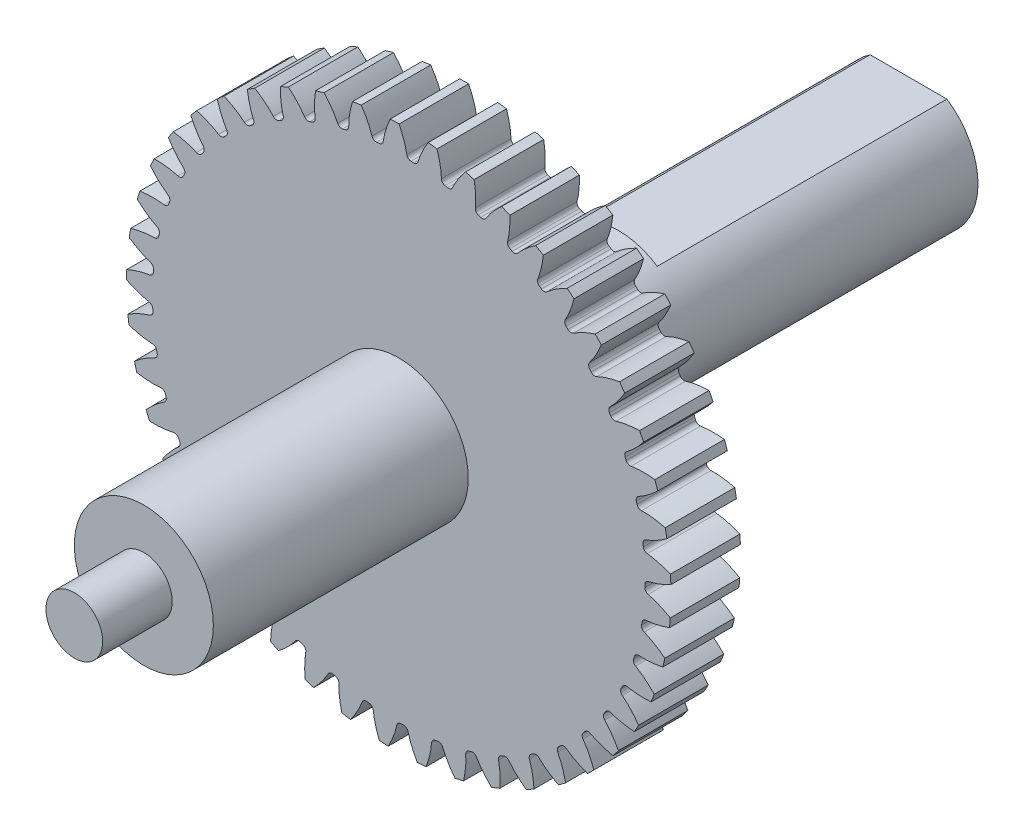
from build123d import *

# Parameters (mm, degrees)
SKETCH1_R           = 3
BOSS_EXTRUDE1_DEPTH = 33
SKETCH1_3_R         = 1.225
BOSS_EXTRUDE2_DEPTH = 36
CUT_EXTRUDE1_DEPTH  = 12.5
SKETCH5_R           = 10.625
BOSS_EXTRUDE3_DEPTH = 3
BOSS_EXTRUDE5_DEPTH = 3
CIRPATTERN1_COUNT   = 45


with BuildPart() as part:
    # Sketch1 → Boss-Extrude1 (new body)
    with BuildSketch(Plane.XY):
        Circle(SKETCH1_R)
    extrude(amount=BOSS_EXTRUDE1_DEPTH)

    # Sketch1<3> → Boss-Extrude2 (add)
    with BuildSketch(Plane.XY):
        Circle(SKETCH1_3_R)
    extrude(amount=BOSS_EXTRUDE2_DEPTH)

    # Sketch3 → Cut-Extrude1 (cut)
    with BuildSketch(Plane(origin=(0, 0, 0), x_dir=(-1, 0, 0), z_dir=(0, 0, -1))):
        with BuildLine():
            Line((-1.658312395, 2.5), (1.658312395, 2.5))
            ThreePointArc((1.658312395, 2.5), (0, 3), (-1.658312395, 2.5))
        make_face()
    extrude(amount=-CUT_EXTRUDE1_DEPTH, mode=Mode.SUBTRACT)

    # Sketch5 → Boss-Extrude3 (add)
    with BuildSketch(Plane.XY.offset(19)):
        Circle(SKETCH5_R)
    extrude(amount=BOSS_EXTRUDE3_DEPTH)

    # Sketch5<3> → Boss-Extrude5 (add)
    with BuildSketch(Plane.XY.offset(19)):
        with BuildLine():
            add(Edge.make_bspline(
                [(10.776484352, 0.02719463), (10.806732004, 0.033258222), (10.86082589, 0.045217944), (10.938321541, 0.06482523), (11.038588861, 0.094249349), (11.131873873, 0.124747653), (11.224305748, 0.157895215), (11.315781025, 0.193362424), (11.425813466, 0.239194384), (11.544483316, 0.292654479), (11.639659509, 0.339180983), (11.711835129, 0.376368108), (11.743425413, 0.393013451)],
                knots=[0.05770511, 0.05770511, 0.05770511, 0.05770511, 0.05770511, 0.092110525, 0.119476176, 0.146842496, 0.174208854, 0.201574956, 0.228941013, 0.256307345, 0.307035032, 0.346884984, 0.346884984, 0.346884984, 0.346884984, 0.346884984], degree=4))
            ThreePointArc((11.743425413, 0.393013451), (11.735426348, 0.585037119), (11.724287601, 0.776904266))
            add(Edge.make_bspline(
                [(10.725757452, 1.044739973), (10.7564582, 1.041714795), (10.81147336, 1.035194402), (10.890534862, 1.023391838), (10.993231483, 1.004085923), (11.089087251, 0.983016708), (11.1843576, 0.95922652), (11.278906799, 0.933033045), (11.392952003, 0.898371854), (11.516350463, 0.856979402), (11.615682156, 0.82014955), (11.691198447, 0.790325195), (11.724287601, 0.776904266)],
                knots=[0.05770511, 0.05770511, 0.05770511, 0.05770511, 0.05770511, 0.092110525, 0.119476176, 0.146842496, 0.174208854, 0.201574956, 0.228941013, 0.256307345, 0.307035032, 0.346884984, 0.346884984, 0.346884984, 0.346884984, 0.346884984], degree=4))
            ThreePointArc((10.725757452, 1.044739973), (10.611125812, 1.098395914), (10.555629865, 1.212148157))
            ThreePointArc((10.555629865, 1.212148157), (10.607643289, 0.607065765), (10.625, 0))
            ThreePointArc((10.625, 0), (10.624712558, -0.078154086), (10.623850247, -0.156303943))
            ThreePointArc((10.623850247, -0.156303943), (10.667757548, -0.037596226), (10.776484352, 0.02719463))
        make_face()
    boss_extrude5 = extrude(amount=BOSS_EXTRUDE5_DEPTH)

    # CirPattern1: Boss-Extrude5 ×45 about axis
    cirpattern1_axis = Axis((0, 0, 22), (0, 0, -1))
    for i in range(1, CIRPATTERN1_COUNT):
        add(boss_extrude5.rotate(cirpattern1_axis, i * 360 / CIRPATTERN1_COUNT))


solid = part.part
